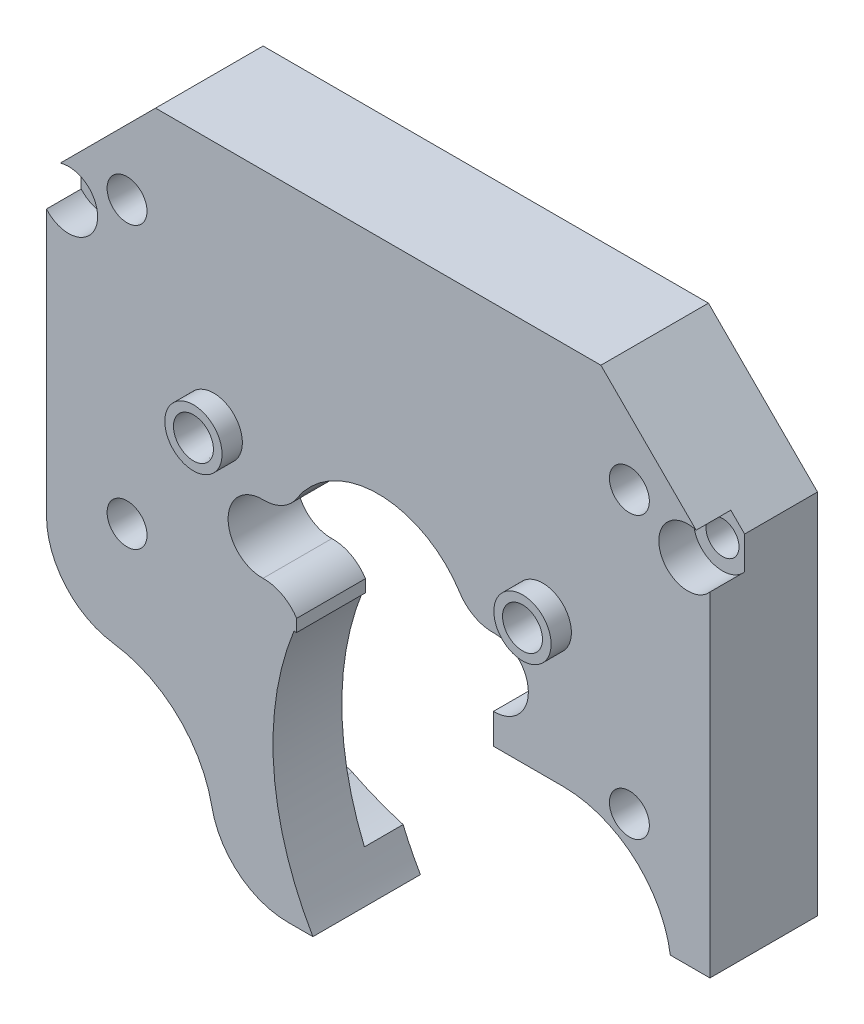
from build123d import *
from build123d.topology import SkipClean

# Parameters (mm, degrees)
SKETCH1_R                                       = 24.7015
SKETCH1_R_2                                     = 7.9375
BOSS_EXTRUDE1_DEPTH                             = 5.65
CBORE_SLOT_FOR_2_PAN_HEAD_MACHINE_SCREW_DEPTH   = 7
CBORE_SLOT_FOR_2_PAN_HEAD_MACHINE_S_3_DEPTH     = 1.5748
BOSS_EXTRUDE5_DEPTH                             = 12.7
BOSS_EXTRUDE7_DEPTH                             = 12.7
SKETCH32_R                                      = 24.7015
BOSS_EXTRUDE8_DEPTH                             = 18.35
CUT_EXTRUDE1_DEPTH                              = 12.7
CUT_EXTRUDE2_START                              = -12.7
CUT_EXTRUDE2_DEPTH                              = 12.7
CUT_EXTRUDE3_START                              = -12.7
CUT_EXTRUDE3_DEPTH                              = 12.7
HOLE1_AT_2_COUNT                                = 2
HOLE1_AT_2_PITCH                                = 23.0346
HOLE1_AT_3_COUNT                                = 2
HOLE1_AT_3_PITCH                                = 41.21845798
HOLE1_AT_4_COUNT                                = 2
HOLE1_AT_4_PITCH                                = 47.218154088
F_3_0_3_DIAMETER_HOLE1_D                        = 3
SKETCH44_R                                      = 2.794
CUT_EXTRUDE4_DEPTH                              = 43.051540364
FILLET1_R                                       = 1.27
CUT_EXTRUDE5_DEPTH                              = 43.051540364
SKETCH46_R                                      = 24.3332
BOSS_EXTRUDE9_DEPTH                             = 3.175
FILLET3_R                                       = 3.175
BOSS_EXTRUDE10_DEPTH                            = 8.825
FILLET2_R                                       = 1.27
SKETCH48_R                                      = 9.525
CUT_EXTRUDE6_DEPTH                              = 43.594485375
FILLET4_R                                       = 6.35
FILLET5_R                                       = 1.27
CBORE_FOR_2_PAN_HEAD_MACHINE_SCREW1_D           = 2.7051
CBORE_FOR_2_PAN_HEAD_MACHINE_SCREW1_CBORE_D     = 4.7625
CBORE_FOR_2_PAN_HEAD_MACHINE_SCREW1_CBORE_DEPTH = 2.8448
CUT_EXTRUDE7_REACH                              = 40.805
SKETCH52_W                                      = 3.519428238
SKETCH52_H                                      = 2.477388191
SKETCH52_W_2                                    = 0.760947706
SKETCH52_H_2                                    = 1.008283928
SKETCH52_W_3                                    = 24.09425798
SKETCH52_H_3                                    = 13.354210358
CUT_EXTRUDE8_DEPTH                              = 39.805102427
SKETCH53_R                                      = 2.35
BOSS_EXTRUDE11_DEPTH                            = 1.663
BOSS_EXTRUDE12_DEPTH                            = 5.65
F_0_CLEARANCE_HOLE1_D                           = 1.8542
HOLE2_AT_2_COUNT                                = 2
HOLE2_AT_2_PITCH                                = 27


with BuildPart() as part:
    # Sketch1 → Boss-Extrude1 (new body)
    with BuildSketch(Plane.XY):
        with Locations(Location((0, 0, 0), (0, 0, 180))):
            Circle(SKETCH1_R)
        with Locations(Location((0, 0, 0), (0, 0, 180))):
            Circle(SKETCH1_R_2, mode=Mode.SUBTRACT)
    extrude(amount=BOSS_EXTRUDE1_DEPTH)

    # CBORE SLOT for #2 Pan Head Machine Screw1: read off the stored shape, not the designer's step
    # CBORE SLOT for _2 Pan Head Machine S 2 → CBORE SLOT for #2 Pan Head Machine Screw1 (cut)
    with BuildSketch(Plane.XY):
        with BuildLine():
            ThreePointArc((-6.14045, 18.210667628), (-7.493, 19.563217628), (-8.84555, 18.210667628))
            Line((-8.84555, 18.210667628), (-8.84555, 14.565767628))
            ThreePointArc((-8.84555, 14.565767628), (-7.493, 13.213217628), (-6.14045, 14.565767628))
            Line((-6.14045, 14.565767628), (-6.14045, 18.210667628))
        make_face()
        with BuildLine():
            ThreePointArc((3.35915, 18.210667628), (2.0066, 19.563217628), (0.65405, 18.210667628))
            Line((0.65405, 18.210667628), (0.65405, 14.565767628))
            ThreePointArc((0.65405, 14.565767628), (2.0066, 13.213217628), (3.35915, 14.565767628))
            Line((3.35915, 14.565767628), (3.35915, 18.210667628))
        make_face()
    extrude(amount=CBORE_SLOT_FOR_2_PAN_HEAD_MACHINE_SCREW_DEPTH, mode=Mode.SUBTRACT)

    # CBORE SLOT for _2 Pan Head Machine S 3 o → CBORE SLOT for _2 Pan Head Machine S 3 (cut)
    # profile 1 of 2: a face of its own
    with BuildSketch(Plane.XY):
        with BuildLine():
            ThreePointArc((-5.11175, 18.210667628), (-7.493, 20.591917628), (-9.87425, 18.210667628))
            Line((-9.87425, 18.210667628), (-9.87425, 14.565767628))
            ThreePointArc((-9.87425, 14.565767628), (-7.493, 12.184517628), (-5.11175, 14.565767628))
            Line((-5.11175, 14.565767628), (-5.11175, 18.210667628))
        make_face()
        with BuildLine():
            Line((-8.84555, 14.565767628), (-8.84555, 18.210667628))
            ThreePointArc((-8.84555, 18.210667628), (-7.493, 19.563217628), (-6.14045, 18.210667628))
            Line((-6.14045, 18.210667628), (-6.14045, 14.565767628))
            ThreePointArc((-6.14045, 14.565767628), (-7.493, 13.213217628), (-8.84555, 14.565767628))
        make_face(mode=Mode.SUBTRACT)
    # profile 2 of 2: a face of its own
    with BuildSketch(Plane.XY):
        with BuildLine():
            ThreePointArc((4.38785, 18.210667628), (2.0066, 20.591917628), (-0.37465, 18.210667628))
            Line((-0.37465, 18.210667628), (-0.37465, 14.565767628))
            ThreePointArc((-0.37465, 14.565767628), (2.0066, 12.184517628), (4.38785, 14.565767628))
            Line((4.38785, 14.565767628), (4.38785, 18.210667628))
        make_face()
        with BuildLine():
            Line((0.65405, 14.565767628), (0.65405, 18.210667628))
            ThreePointArc((0.65405, 18.210667628), (2.0066, 19.563217628), (3.35915, 18.210667628))
            Line((3.35915, 18.210667628), (3.35915, 14.565767628))
            ThreePointArc((3.35915, 14.565767628), (2.0066, 13.213217628), (0.65405, 14.565767628))
        make_face(mode=Mode.SUBTRACT)
    extrude(amount=CBORE_SLOT_FOR_2_PAN_HEAD_MACHINE_S_3_DEPTH, mode=Mode.SUBTRACT)

    # CBORE SLOT for _2 Pan Head Machine S 4: loft between two sections, ruled curve by curve
    cbore_slot_for_2_pan_head_machine_s_4_from = [
        Edge.make_three_point_arc((-9.87425, 18.210667628, 1.03251), (-9.176798023, 19.89446565, 1.03251), (-7.493, 20.591917628, 1.03251)),
        Edge.make_three_point_arc((-7.493, 20.591917628, 1.03251), (-5.809201977, 19.89446565, 1.03251), (-5.11175, 18.210667628, 1.03251)),
        Edge.make_three_point_arc((-5.11175, 14.565767628, 1.03251), (-5.809201977, 12.881969605, 1.03251), (-7.493, 12.184517628, 1.03251)),
        Edge.make_three_point_arc((-7.493, 12.184517628, 1.03251), (-9.176798023, 12.881969605, 1.03251), (-9.87425, 14.565767628, 1.03251)),
        Edge.make_line((-5.11175, 18.210667628, 1.03251), (-5.11175, 14.565767628, 1.03251)),
        Edge.make_line((-9.87425, 18.210667628, 1.03251), (-9.87425, 14.565767628, 1.03251)),
    ]
    cbore_slot_for_2_pan_head_machine_s_4_to = [
        Edge.make_three_point_arc((-10.90676, 18.210667628, 0), (-9.906892845, 20.624560473, 0), (-7.493, 21.624427628, 0)),
        Edge.make_three_point_arc((-7.493, 21.624427628, 0), (-5.079107155, 20.624560473, 0), (-4.07924, 18.210667628, 0)),
        Edge.make_three_point_arc((-4.07924, 14.565767628, 0), (-5.079107155, 12.151874782, 0), (-7.493, 11.152007628, 0)),
        Edge.make_three_point_arc((-7.493, 11.152007628, 0), (-9.906892845, 12.151874782, 0), (-10.90676, 14.565767628, 0)),
        Edge.make_line((-4.07924, 18.210667628, 0), (-4.07924, 14.565767628, 0)),
        Edge.make_line((-10.90676, 18.210667628, 0), (-10.90676, 14.565767628, 0)),
    ]
    cbore_slot_for_2_pan_head_machine_s_4 = Solid(Shell([*[Face.make_surface_from_curves(cbore_slot_for_2_pan_head_machine_s_4_from[k], cbore_slot_for_2_pan_head_machine_s_4_to[k]) for k in range(6)], Face(Wire(cbore_slot_for_2_pan_head_machine_s_4_from)), Face(Wire(cbore_slot_for_2_pan_head_machine_s_4_to))]))
    add(cbore_slot_for_2_pan_head_machine_s_4, mode=Mode.SUBTRACT)

    # CBORE SLOT for _2 Pan Head Machine S 5: loft between two sections, ruled curve by curve
    cbore_slot_for_2_pan_head_machine_s_5_from = [
        Edge.make_three_point_arc((-0.37465, 18.210667628, 1.03251), (0.322801977, 19.89446565, 1.03251), (2.0066, 20.591917628, 1.03251)),
        Edge.make_three_point_arc((2.0066, 20.591917628, 1.03251), (3.690398023, 19.89446565, 1.03251), (4.38785, 18.210667628, 1.03251)),
        Edge.make_three_point_arc((4.38785, 14.565767628, 1.03251), (3.690398023, 12.881969605, 1.03251), (2.0066, 12.184517628, 1.03251)),
        Edge.make_three_point_arc((2.0066, 12.184517628, 1.03251), (0.322801977, 12.881969605, 1.03251), (-0.37465, 14.565767628, 1.03251)),
        Edge.make_line((4.38785, 18.210667628, 1.03251), (4.38785, 14.565767628, 1.03251)),
        Edge.make_line((-0.37465, 18.210667628, 1.03251), (-0.37465, 14.565767628, 1.03251)),
    ]
    cbore_slot_for_2_pan_head_machine_s_5_to = [
        Edge.make_three_point_arc((-1.40716, 18.210667628, 0), (-0.407292845, 20.624560473, 0), (2.0066, 21.624427628, 0)),
        Edge.make_three_point_arc((2.0066, 21.624427628, 0), (4.420492845, 20.624560473, 0), (5.42036, 18.210667628, 0)),
        Edge.make_three_point_arc((5.42036, 14.565767628, 0), (4.420492845, 12.151874782, 0), (2.0066, 11.152007628, 0)),
        Edge.make_three_point_arc((2.0066, 11.152007628, 0), (-0.407292845, 12.151874782, 0), (-1.40716, 14.565767628, 0)),
        Edge.make_line((5.42036, 18.210667628, 0), (5.42036, 14.565767628, 0)),
        Edge.make_line((-1.40716, 18.210667628, 0), (-1.40716, 14.565767628, 0)),
    ]
    cbore_slot_for_2_pan_head_machine_s_5 = Solid(Shell([*[Face.make_surface_from_curves(cbore_slot_for_2_pan_head_machine_s_5_from[k], cbore_slot_for_2_pan_head_machine_s_5_to[k]) for k in range(6)], Face(Wire(cbore_slot_for_2_pan_head_machine_s_5_from)), Face(Wire(cbore_slot_for_2_pan_head_machine_s_5_to))]))
    add(cbore_slot_for_2_pan_head_machine_s_5, mode=Mode.SUBTRACT)

    # Sketch11 → Boss-Extrude5 (add)
    with SkipClean():  # the faces are left unmerged after this step: merging them gives an invalid solid
        with BuildSketch(Plane.XY.offset(5.65)):
            with BuildLine():
                Line((-24.288147361, -4.5), (-11.876026271, -4.5))
                ThreePointArc((-11.876026271, -4.5), (0, -12.7), (11.876026271, -4.5))
                Line((11.876026271, -4.5), (24.288147361, -4.5))
                ThreePointArc((24.288147361, -4.5), (0, -24.7015), (-24.288147361, -4.5))
            make_face()
        extrude(amount=BOSS_EXTRUDE5_DEPTH)

    # Sketch17 → Boss-Extrude7 (add)
    with SkipClean():  # the faces are left unmerged after this step: merging them gives an invalid solid
        with BuildSketch(Plane.XY.offset(5.65)):
            with BuildLine():
                Line((-24.288147361, -4.5), (-20.478147361, -4.5))
                Line((-20.478147361, -4.5), (-20.478147361, 4.39))
                ThreePointArc((-20.478147361, 4.39), (-17.953053751, 10.784919117), (-13.493147361, 16.017540187))
                Line((-13.493147361, 16.017540187), (-13.493147361, 20.69055525))
                ThreePointArc((-13.493147361, 20.69055525), (-22.704571702, 9.729672455), (-24.288147361, -4.5))
            make_face()
            with BuildLine():
                Line((20.478147361, -4.5), (20.478147361, 4.39))
                ThreePointArc((20.478147361, 4.39), (17.953053751, 10.784919117), (13.493147361, 16.017540187))
                Line((13.493147361, 16.017540187), (13.493147361, 20.69055525))
                ThreePointArc((13.493147361, 20.69055525), (22.704571702, 9.729672455), (24.288147361, -4.5))
                Line((24.288147361, -4.5), (20.478147361, -4.5))
            make_face()
        extrude(amount=BOSS_EXTRUDE7_DEPTH)

    # Sketch32 → Boss-Extrude8 (add)
    with BuildSketch(Plane(origin=(0, 0, 0), x_dir=(-1, 0, 0), z_dir=(0, 0, -1))):
        Polygon((18.271623193, 26.2128), (27.21845798, 17.265965213), (27.21845798, -16.73945567), (29.68945567, -16.73945567), (29.68945567, -29.23945567), (16.28945567, -29.23945567), (16.28945567, -26.2128), (-18.271623193, -26.2128), (-27.21845798, -17.265965213), (-27.21845798, 17.265965213), (-18.271623193, 26.2128), align=None)
        Circle(SKETCH32_R, mode=Mode.SUBTRACT)
    extrude(amount=-BOSS_EXTRUDE8_DEPTH)

    # Sketch33 → Cut-Extrude1 (cut)
    with BuildSketch(Plane.XY.offset(18.35)):
        Polygon((-13.493147361, 20.69055525), (13.493147361, 20.69055525), (13.493147361, 22.4028), (13.493147361, 26.2128), (-13.493147361, 26.2128), (-13.493147361, 22.4028), align=None)
    extrude(amount=-CUT_EXTRUDE1_DEPTH, mode=Mode.SUBTRACT)

    # Sketch35 → Cut-Extrude2 (cut)
    with BuildSketch(Plane.XY.offset(18.35).offset(CUT_EXTRUDE2_START)):
        with BuildLine():
            Line((-20.478147361, -4.5), (-20.478147361, 4.39))
            ThreePointArc((-20.478147361, 4.39), (-17.953053751, 10.784919117), (-13.493147361, 16.017540187))
            Line((-13.493147361, 16.017540187), (-13.493147361, 25.603122159))
            Line((-13.493147361, 25.603122159), (-23.40845798, 15.68781154))
            Line((-23.40845798, 15.68781154), (-23.40845798, -4.5))
            Line((-23.40845798, -4.5), (-20.478147361, -4.5))
        make_face()
        with BuildLine():
            Line((13.493147361, 25.603122159), (13.493147361, 16.017540187))
            ThreePointArc((13.493147361, 16.017540187), (17.953053751, 10.784919117), (20.478147361, 4.39))
            Line((20.478147361, 4.39), (20.478147361, -4.5))
            Line((20.478147361, -4.5), (23.40845798, -4.5))
            Line((23.40845798, -4.5), (23.40845798, 15.68781154))
            Line((23.40845798, 15.68781154), (13.493147361, 25.603122159))
        make_face()
    extrude(amount=CUT_EXTRUDE2_DEPTH, mode=Mode.SUBTRACT)

    # Sketch37 → Cut-Extrude3 (cut)
    with BuildSketch(Plane.XY.offset(18.35).offset(CUT_EXTRUDE3_START)):
        with BuildLine():
            Line((-23.40845798, 15.68781154), (-13.493147361, 25.603122159))
            Line((-13.493147361, 25.603122159), (-13.493147361, 26.2128))
            Line((-13.493147361, 26.2128), (-18.271623193, 26.2128))
            Line((-18.271623193, 26.2128), (-27.21845798, 17.265965213))
            Line((-27.21845798, 17.265965213), (-27.21845798, -16.73945567))
            Line((-27.21845798, -16.73945567), (-29.68945567, -16.73945567))
            Line((-29.68945567, -16.73945567), (-29.68945567, -29.23945567))
            Line((-29.68945567, -29.23945567), (-16.28945567, -29.23945567))
            Line((-16.28945567, -29.23945567), (-16.28945567, -26.2128))
            Line((-16.28945567, -26.2128), (18.271623193, -26.2128))
            Line((18.271623193, -26.2128), (27.21845798, -17.265965213))
            Line((27.21845798, -17.265965213), (27.21845798, 17.265965213))
            Line((27.21845798, 17.265965213), (18.271623193, 26.2128))
            Line((18.271623193, 26.2128), (13.493147361, 26.2128))
            Line((13.493147361, 26.2128), (13.493147361, 25.603122159))
            Line((13.493147361, 25.603122159), (23.40845798, 15.68781154))
            Line((23.40845798, 15.68781154), (23.40845798, -4.5))
            Line((23.40845798, -4.5), (11.876026271, -4.5))
            ThreePointArc((11.876026271, -4.5), (0, -12.7), (-11.876026271, -4.5))
            Line((-11.876026271, -4.5), (-23.40845798, -4.5))
            Line((-23.40845798, -4.5), (-23.40845798, 15.68781154))
        make_face()
    extrude(amount=CUT_EXTRUDE3_DEPTH, mode=Mode.SUBTRACT)

    # Sketch40 → Hole1 (revolve, cut)
    with BuildSketch(Plane(origin=(-20.60922899, 18.5346, 5.65), x_dir=(0, -1, 0), z_dir=(1, 0, 0))):
        Polygon((0, 0), (0, 2.921), (1.4986, 2.921), (1.6383, 0), align=None)
    hole1 = revolve(axis=Axis((-20.60922899, 18.5346, -104.35), (0, 0, 1)), mode=Mode.SUBTRACT)

    # Hole1 at 2: Hole1 ×2
    with Locations(*[(0, -i * HOLE1_AT_2_PITCH, 0) for i in range(1, HOLE1_AT_2_COUNT)]):
        add(hole1, mode=Mode.SUBTRACT)

    # Hole1 at 3: Hole1 ×2
    with Locations(*[(i * HOLE1_AT_3_PITCH, 0, 0) for i in range(1, HOLE1_AT_3_COUNT)]):
        add(hole1, mode=Mode.SUBTRACT)

    # Hole1 at 4: Hole1 ×2
    with Locations(*[Vector(0.8729366655021837, -0.48783355565390196, 0) * (i * HOLE1_AT_4_PITCH) for i in range(1, HOLE1_AT_4_COUNT)]):
        add(hole1, mode=Mode.SUBTRACT)

    # Ø3.0 (3) Diameter Hole1 (through all)
    with Locations(Plane.XY.offset(5.65)):
        with Locations((-20.60922899, 18.5346), (20.60922899, 18.5346), (-20.60922899, -4.5), (20.60922899, -4.5)):
            Hole(F_3_0_3_DIAMETER_HOLE1_D / 2)

    # Sketch44 → Cut-Extrude4 (cut, through all)
    with BuildSketch(Plane.XY.offset(5.65)):
        with Locations((-9.525, 0)):
            Circle(SKETCH44_R)
        with Locations((9.525, 0)):
            Circle(SKETCH44_R)
    extrude(amount=-CUT_EXTRUDE4_DEPTH, mode=Mode.SUBTRACT)

    # Fillet1
    fillet1_edges = [part.edges().sort_by_distance(p)[0] for p in [
        (-16.28945567, -26.2128, 2.825),
        (-27.21845798, -16.73945567, 2.825),
    ]]
    fillet(fillet1_edges, radius=FILLET1_R)

    # Sketch45 → Cut-Extrude5 (cut, through all)
    with BuildSketch(Plane(origin=(0, 0, 0), x_dir=(-1, 0, 0), z_dir=(0, 0, -1))):
        Polygon((19.525354055, -16.98945567), (16.06125244, -22.98945567), (19.525354055, -28.98945567), (26.453557285, -28.98945567), (29.9176589, -22.98945567), (26.453557285, -16.98945567), align=None)
    extrude(amount=-CUT_EXTRUDE5_DEPTH, mode=Mode.SUBTRACT)

    # Sketch46 → Boss-Extrude9 (add)
    with BuildSketch(Plane(origin=(0, 0, 0), x_dir=(-1, 0, 0), z_dir=(0, 0, -1))):
        with BuildLine():
            Line((19.525354055, -16.98945567), (26.453557285, -16.98945567))
            Line((26.453557285, -16.98945567), (29.68945567, -22.594196081))
            Line((29.68945567, -22.594196081), (29.68945567, -16.73945567))
            Line((29.68945567, -16.73945567), (28.48845798, -16.73945567))
            ThreePointArc((28.48845798, -16.73945567), (27.590432368, -16.367481282), (27.21845798, -15.46945567))
            Line((27.21845798, -15.46945567), (27.21845798, 17.265965213))
            Line((27.21845798, 17.265965213), (18.271623193, 26.2128))
            Line((18.271623193, 26.2128), (-18.271623193, 26.2128))
            Line((-18.271623193, 26.2128), (-27.21845798, 17.265965213))
            Line((-27.21845798, 17.265965213), (-27.21845798, -17.265965213))
            Line((-27.21845798, -17.265965213), (-18.271623193, -26.2128))
            Line((-18.271623193, -26.2128), (15.01945567, -26.2128))
            ThreePointArc((15.01945567, -26.2128), (15.917481282, -26.584774388), (16.28945567, -27.4828))
            Line((16.28945567, -27.4828), (16.28945567, -29.23945567))
            Line((16.28945567, -29.23945567), (29.68945567, -29.23945567))
            Line((29.68945567, -29.23945567), (29.68945567, -23.384715259))
            Line((29.68945567, -23.384715259), (26.453557285, -28.98945567))
            Line((26.453557285, -28.98945567), (19.525354055, -28.98945567))
            Line((19.525354055, -28.98945567), (16.06125244, -22.98945567))
            Line((16.06125244, -22.98945567), (19.525354055, -16.98945567))
        make_face()
        Circle(SKETCH46_R, mode=Mode.SUBTRACT)
    extrude(amount=BOSS_EXTRUDE9_DEPTH)

    # Fillet3
    fillet3_edges = [part.edges().sort_by_distance(p)[0] for p in [
        (-7.660005, -2.080439773, 2.825),
        (-7.660005, 2.080439773, 2.825),
        (7.660005, 2.080439773, 2.825),
        (7.660005, -2.080439773, 2.825),
    ]]
    fillet(fillet3_edges, radius=FILLET3_R)

    # Sketch47 → Boss-Extrude10 (add, through all)
    with BuildSketch(Plane.XY.offset(5.65)):
        Polygon((-29.68945567, -22.594196081), (-29.68945567, -28.98945567), (-19.525354055, -28.98945567), (-16.06125244, -22.98945567), (-19.525354055, -16.98945567), (-26.453557285, -16.98945567), align=None)
    extrude(amount=-BOSS_EXTRUDE10_DEPTH)

    # Fillet2
    fillet2_edges = [part.edges().sort_by_distance(p)[0] for p in [
        (-29.68945567, -16.73945567, 1.2375),
        (-16.28945567, -29.23945567, 1.2375),
        (-29.68945567, -29.23945567, 1.2375),
    ]]
    fillet(fillet2_edges, radius=FILLET2_R)

    # Sketch48 → Cut-Extrude6 (cut, through all)
    with BuildSketch(Plane(origin=(0, 0, -3.175), x_dir=(-1, 0, 0), z_dir=(0, 0, -1))):
        with Locations((22.98945567, -22.98945567)):
            Circle(SKETCH48_R)
    extrude(amount=-CUT_EXTRUDE6_DEPTH, mode=Mode.SUBTRACT)

    # Fillet4
    fillet4_edges = [part.edges().sort_by_distance(p)[0] for p in [
        (-27.21845798, -14.454752133, 1.2375),
        (-14.026438526, -26.2128, 1.2375),
    ]]
    fillet(fillet4_edges, radius=FILLET4_R)

    # Fillet5
    # the kernel refuses this fillet: 1.27 mm, written as the material it takes off along each edge
    with BuildSketch(Plane(origin=(-19.922151482, -13.971846784, -11.170229406), x_dir=(-0.9724814698737868, 0.23298023682733077, 0), z_dir=(0, 0, 1))) as fillet5_piece_1:
        with BuildLine():
            CenterArc((3.055421954, -1.261960905), FILLET5_R, 83.549866432, 137.955138996)
            Line((2.104321709, -2.103571459), (2.009211684, -2.187732514))
            ThreePointArc((2.009211684, -2.187732514), (0.994557133, -1.109409995), (-0.084127135, -0.09514003))
            Line((-0.084127135, -0.09514003), (0.011759624, 0.126454384))
            ThreePointArc((0.011759624, 0.126454384), (1.830812196, 0.134099872), (3.212358743, 0.12619609))
            Line((3.212358743, 0.12619609), (3.198091762, 0))
        make_face()
    extrude(amount=11.170229406, mode=Mode.SUBTRACT)
    with BuildSketch(Plane(origin=(-13.971846784, -19.922151482, -13.061671613), x_dir=(0.3595032559739515, -0.9331438307914421, 0), z_dir=(0, 0, 1))) as fillet5_piece_2:
        with BuildLine():
            CenterArc((3.623351594, 1.22602162), FILLET5_R, 132.177237222, 152.945021751)
            Line((2.770640288, 2.167182301), (2.685369157, 2.261298369))
            ThreePointArc((2.685369157, 2.261298369), (1.346286207, 1.133494196), (-0.070810586, 0.10542704))
            Line((-0.070810586, 0.10542704), (-0.00506165, -0.126899093))
            ThreePointArc((-0.00506165, -0.126899093), (1.205578867, -0.254088239), (3.98780035, -0.122602162))
            Line((3.98780035, -0.122602162), (3.954668645, 0))
        make_face()
    extrude(amount=13.061671613, mode=Mode.SUBTRACT)

    # CBORE for #2 Pan Head Machine Screw1 (through all)
    with Locations(Plane.XY.offset(5.65)):
        with Locations((-25.405939599, 16.116198413), (25.405939599, 16.116198413), (17.204531454, -24.681930955)):
            CounterBoreHole(CBORE_FOR_2_PAN_HEAD_MACHINE_SCREW1_D / 2, CBORE_FOR_2_PAN_HEAD_MACHINE_SCREW1_CBORE_D / 2, CBORE_FOR_2_PAN_HEAD_MACHINE_SCREW1_CBORE_DEPTH)

    # Sketch51 → Cut-Extrude7 (cut, up to next)
    with BuildSketch(Plane.XY.offset(-3.175), mode=Mode.PRIVATE) as cut_extrude7_sk1:
        with BuildLine():
            Line((-6.914291209, -5.2705), (15.1765, -5.2705))
            ThreePointArc((15.1765, -5.2705), (23.389789044, -17.562555714), (8.890320715, -20.446679285))
            Line((8.890320715, -20.446679285), (-1.661480227, -30.998480227))
            ThreePointArc((-1.661480227, -30.998480227), (-8.154692705, -18.923965464), (-6.914291209, -5.2705))
        make_face()
    cut_extrude7_tool1 = extrude(cut_extrude7_sk1.sketch, amount=CUT_EXTRUDE7_REACH, mode=Mode.PRIVATE) & part.part
    add(cut_extrude7_tool1.solids().sort_by_distance((6.304023, -15.146754, -3.175))[0], mode=Mode.SUBTRACT)

    # Sketch52 → Cut-Extrude8 (cut, through all)
    with BuildSketch(Plane.XY.offset(5.65)):
        with Locations((7.694841413, -4.031805905)):
            Rectangle(SKETCH52_W, SKETCH52_H)
        with Locations((-6.315601147, -4.766358036)):
            Rectangle(SKETCH52_W_2, SKETCH52_H_2)
        with Locations((15.17132899, -19.535694821)):
            Rectangle(SKETCH52_W_3, SKETCH52_H_3)
    extrude(amount=-CUT_EXTRUDE8_DEPTH, mode=Mode.SUBTRACT)


with BuildPart() as cut_extrude8_kept_piece:
    # of the separate pieces the step leaves, the one the design keeps (cut_extrude8_pieces_kept)
    add(part.part.solids().sort_by_distance((18.271623193, 26.2128, 5.65))[0])

    # Sketch53 → Boss-Extrude11 (add)
    with BuildSketch(Plane.XY.offset(5.65)):
        with Locations(Location((13.5, 6, 0), (0, 0, 180))):
            Circle(SKETCH53_R)
        with Locations(Location((-13.5, 6, 0), (0, 0, 180))):
            Circle(SKETCH53_R)
    extrude(amount=BOSS_EXTRUDE11_DEPTH)

    # Sketch54 → Boss-Extrude12 (add)
    with BuildSketch(Plane(origin=(0, 0, 0), x_dir=(-1, 0, 0), z_dir=(0, 0, -1))):
        with BuildLine():
            Line((1.40716, 14.565767628), (1.40716, 18.210667628))
            ThreePointArc((1.40716, 18.210667628), (-2.0066, 21.624427628), (-5.42036, 18.210667628))
            Line((-5.42036, 18.210667628), (-5.42036, 14.565767628))
            ThreePointArc((-5.42036, 14.565767628), (-2.0066, 11.152007628), (1.40716, 14.565767628))
        make_face()
        with BuildLine():
            Line((4.07924, 18.210667628), (4.07924, 14.565767628))
            ThreePointArc((4.07924, 14.565767628), (7.493, 11.152007628), (10.90676, 14.565767628))
            Line((10.90676, 14.565767628), (10.90676, 18.210667628))
            ThreePointArc((10.90676, 18.210667628), (7.493, 21.624427628), (4.07924, 18.210667628))
        make_face()
    extrude(amount=-BOSS_EXTRUDE12_DEPTH)

    # #0 Clearance Hole1 (through all)
    with Locations(Plane(origin=(0, 0, 0), x_dir=(-1, 0, 0), z_dir=(0, 0, -1))):
        with Locations((-13.5, 6), (13.5, 6)):
            Hole(F_0_CLEARANCE_HOLE1_D / 2)

    # Sketch58 → Hole2 (revolve, cut)
    with BuildSketch(Plane(origin=(-13.5, 6, 7.313), x_dir=(0, -1, 0), z_dir=(1, 0, 0))):
        Polygon((0, 0), (0, 2.921), (1.4986, 2.921), (1.6383, 0), align=None)
    hole2 = revolve(axis=Axis((-13.5, 6, -102.687), (0, 0, 1)), mode=Mode.SUBTRACT)

    # Hole2 at 2: Hole2 ×2
    with Locations(*[(i * HOLE2_AT_2_PITCH, 0, 0) for i in range(1, HOLE2_AT_2_COUNT)]):
        add(hole2, mode=Mode.SUBTRACT)


solid = cut_extrude8_kept_piece.part
